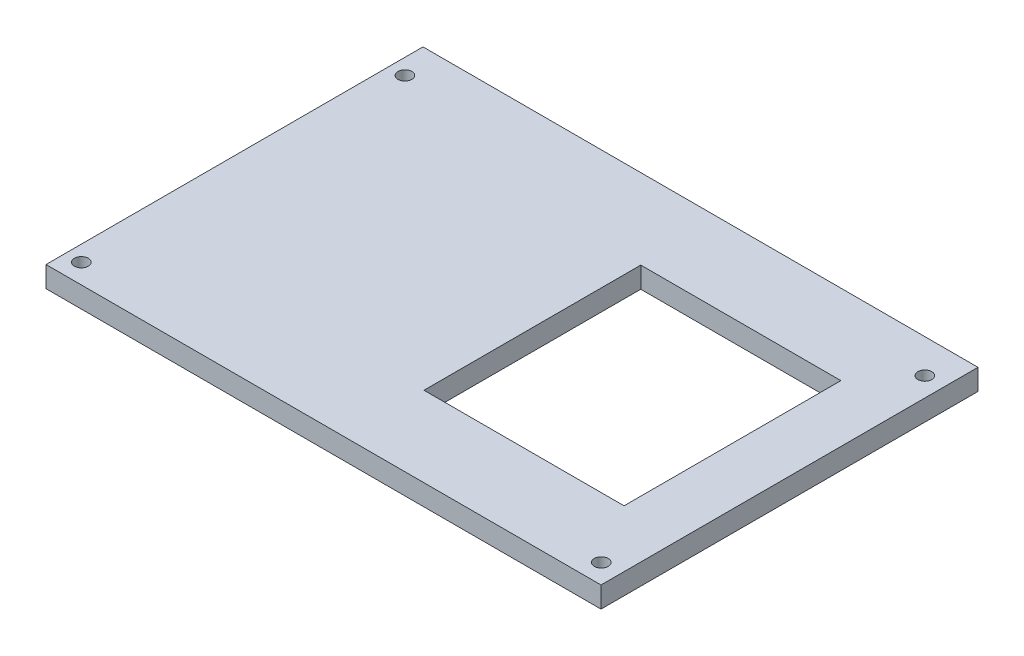
from build123d import *

# Parameters (mm, degrees)
SKETCH2_W           = 106
SKETCH2_H           = 4
BOSS_EXTRUDE1_DEPTH = 72
SKETCH4_R           = 1.325
CUT_EXTRUDE1_DEPTH  = 90.493016487
SKETCH5_R           = 1.75
CUT_EXTRUDE2_DEPTH  = 10
SKETCH6_W           = 38.22100301
SKETCH6_H           = 41.408309334
CUT_EXTRUDE3_DEPTH  = 10


with BuildPart() as part:
    # Sketch2 → Boss-Extrude1 (new body)
    with BuildSketch(Plane.XY):
        Rectangle(SKETCH2_W, SKETCH2_H)
    extrude(amount=BOSS_EXTRUDE1_DEPTH)

    # Sketch4 → Cut-Extrude1 (cut, through all)
    with BuildSketch(Plane(origin=(0, 2, 0), x_dir=(1, 0, 0), z_dir=(0, 1, 0))):
        with Locations((-50.004878073, -68.250693227)):
            Circle(SKETCH4_R)
        with Locations((49.295121927, -68.250693227)):
            Circle(SKETCH4_R)
        with Locations((49.295121927, -6.450693227)):
            Circle(SKETCH4_R)
        with Locations((-50.004878073, -6.450693227)):
            Circle(SKETCH4_R)
    extrude(amount=-CUT_EXTRUDE1_DEPTH, mode=Mode.SUBTRACT)

    # Sketch5 → Cut-Extrude2 (cut)
    with BuildSketch(Plane(origin=(0, 0, 0), x_dir=(-1, 0, 0), z_dir=(0, 0, -1))):
        Circle(SKETCH5_R)
        with Locations((26.5, 0)):
            Circle(SKETCH5_R)
        with Locations((-26.5, 0)):
            Circle(SKETCH5_R)
    extrude(amount=-CUT_EXTRUDE2_DEPTH, mode=Mode.SUBTRACT)

    # Sketch6 → Cut-Extrude3 (cut)
    with BuildSketch(Plane(origin=(0, 2, 0), x_dir=(1, 0, 0), z_dir=(0, 1, 0))):
        with Locations((23, -36)):
            Rectangle(SKETCH6_W, SKETCH6_H)
    extrude(amount=-CUT_EXTRUDE3_DEPTH, mode=Mode.SUBTRACT)


solid = part.part
